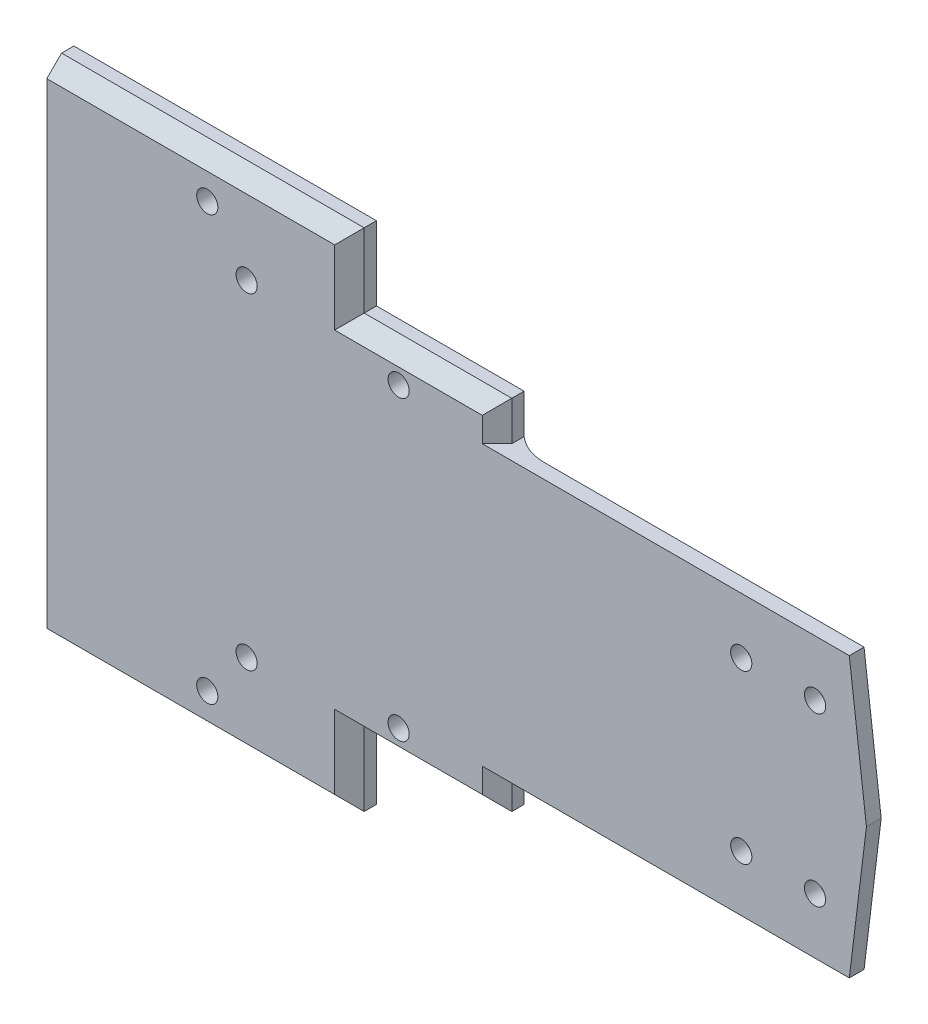
from build123d import *

# Parameters (mm, degrees)
SKETCH1_W           = 142.5
SKETCH1_H           = 56.74
BOSS_EXTRUDE1_DEPTH = 3
CUT_EXTRUDE1_DEPTH  = 77.749067747
SKETCH3_W           = 2.425
SKETCH3_H           = 56.74
CUT_EXTRUDE2_DEPTH  = 77.749067747
SKETCH4_W           = 65
SKETCH4_H           = 8
SKETCH4_H_2         = 56.74
BOSS_EXTRUDE2_DEPTH = 5.5
FILLET1_R           = 10
SKETCH5_R           = 2.15
CUT_EXTRUDE3_DEPTH  = 81.18472049
BOSS_EXTRUDE5_DEPTH = 5.5
CHAMFER6_SIZE       = 3
SKETCH11_R          = 2.15
CUT_EXTRUDE5_DEPTH  = 109.425008762


with BuildPart() as part:
    # Sketch1 → Boss-Extrude1 (new body)
    with BuildSketch(Plane.XY):
        Rectangle(SKETCH1_W, SKETCH1_H)
    extrude(amount=BOSS_EXTRUDE1_DEPTH)

    # Sketch2 → Cut-Extrude1 (cut, through all)
    with BuildSketch(Plane.XY.offset(3)):
        Polygon((67.771628048, 28.37), (71.25, 0), (71.25, 28.37), align=None)
        Polygon((71.25, -28.37), (71.25, 0), (67.771628048, -28.37), align=None)
    extrude(amount=-CUT_EXTRUDE1_DEPTH, mode=Mode.SUBTRACT)

    # Sketch3 → Cut-Extrude2 (cut, through all)
    with BuildSketch(Plane.XY.offset(3)):
        with Locations((-70.0375, 0)):
            Rectangle(SKETCH3_W, SKETCH3_H)
    extrude(amount=-CUT_EXTRUDE2_DEPTH, mode=Mode.SUBTRACT)

    # Sketch4 → Boss-Extrude2 (add)
    with BuildSketch(Plane.XY.offset(3)):
        with Locations((-36.325, 32.37)):
            Rectangle(SKETCH4_W, SKETCH4_H)
        with Locations((-36.325, 0)):
            Rectangle(SKETCH4_W, SKETCH4_H_2)
        with Locations((-36.325, -32.37)):
            Rectangle(SKETCH4_W, SKETCH4_H)
    extrude(amount=-BOSS_EXTRUDE2_DEPTH)

    # Fillet1
    # the kernel refuses this fillet: 10 mm, written as the material it adds along each edge
    with BuildSketch(Plane(origin=(-3.825, 28.37, 0), x_dir=(1, 0, 0), z_dir=(0, -1, 0))) as fillet1_piece_1:
        with BuildLine():
            CenterArc((6.614378278, -10), FILLET1_R, 90, 41.409622109)
            Line((0, -2.5), (-0.132287566, -2.35))
            ThreePointArc((-0.132287566, -2.35), (-0.2, -1.25), (-0.2, 0))
            Line((-0.2, 0), (0, 0.2))
            Line((0, 0.2), (6.614378278, 0.2))
            Line((6.614378278, 0.2), (6.614378278, 0))
        make_face()
    extrude(amount=56.74)

    # Sketch5 → Cut-Extrude3 (cut, through all)
    with BuildSketch(Plane.XY.offset(3)):
        with Locations((60.808027892, 17)):
            Circle(SKETCH5_R)
        with Locations((60.808027892, -17)):
            Circle(SKETCH5_R)
        with Locations((45.808027892, 17)):
            Circle(SKETCH5_R)
        with Locations((45.808027892, -17)):
            Circle(SKETCH5_R)
    extrude(amount=-CUT_EXTRUDE3_DEPTH, mode=Mode.SUBTRACT)

    # Sketch10 → Boss-Extrude5 (add)
    with BuildSketch(Plane.XY.offset(3)):
        Polygon((-68.825, 36.37), (-33.825, 36.37), (-33.825, 51.37), (-68.825, 51.37), (-95.325, 51.37), (-95.325, -51.37), (-68.825, -51.37), (-33.825, -51.37), (-33.825, -36.37), (-68.825, -36.37), align=None)
    extrude(amount=-BOSS_EXTRUDE5_DEPTH)

    # Chamfer6
    chamfer6_edges = [part.edges().sort_by_distance(p)[0] for p in [
        (-18.825, 36.37, 3),
        (-18.825, -36.37, 3),
        (-33.825, 43.87, 3),
        (-64.575, 51.37, 3),
        (-64.575, -51.37, 3),
        (-33.825, -43.87, 3),
        (-3.825, 32.37, 3),
        (-3.825, -32.37, 3),
    ]]
    chamfer(chamfer6_edges, length=CHAMFER6_SIZE)

    # Sketch11 → Cut-Extrude5 (cut, through all)
    with BuildSketch(Plane.XY.offset(3)):
        with Locations((-62.71489096, -43.079989287)):
            Circle(SKETCH11_R)
        with Locations((-54.714891019, -33.183924722)):
            Circle(SKETCH11_R)
        with Locations((-23.821377075, -30.196715875)):
            Circle(SKETCH11_R)
    cut_extrude5 = extrude(amount=-CUT_EXTRUDE5_DEPTH, mode=Mode.SUBTRACT)

    # Mirror2: Cut-Extrude5 across plane
    add(cut_extrude5.mirror(Plane.ZX), mode=Mode.SUBTRACT)


solid = part.part
